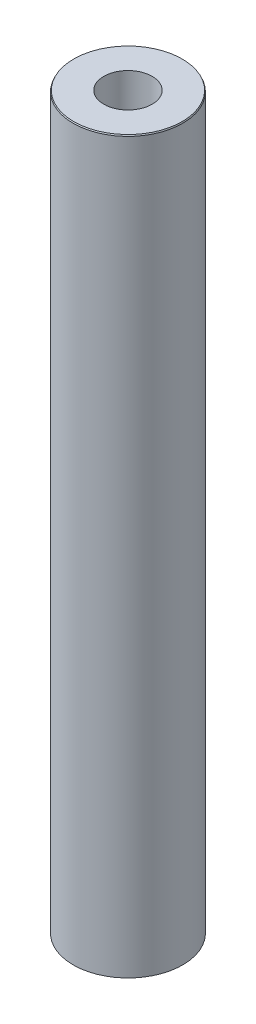
from build123d import *
from OCP.BRepFilletAPI import BRepFilletAPI_MakeChamfer

# Parameters (mm, degrees)
SKETCH1_R           = 45
BOSS_EXTRUDE1_DEPTH = 600
SKETCH2_R           = 19.865410458
CUT_EXTRUDE1_DEPTH  = 604.365560834
CHAMFER1_SIZE       = 0.995548433
CHAMFER1_SIZE2      = 0.469440044


with BuildPart() as part:
    # Sketch1 → Boss-Extrude1 (new body)
    with BuildSketch(Plane(origin=(0, 0, 0), x_dir=(1, 0, 0), z_dir=(0, 1, 0))):
        Circle(SKETCH1_R)
    extrude(amount=BOSS_EXTRUDE1_DEPTH)

    # Sketch2 → Cut-Extrude1 (cut, through all)
    with BuildSketch(Plane(origin=(0, 0, 0), x_dir=(1, 0, 0), z_dir=(0, 1, 0))):
        Circle(SKETCH2_R)
    extrude(amount=CUT_EXTRUDE1_DEPTH, mode=Mode.SUBTRACT)

    # Chamfer1: one chamfer whose edges measure the first distance from different faces: ONE call of the kernel's chamfer builder (chamfer() names one face for all edges)
    chamfer1_edges_1 = [part.edges().sort_by_distance(p)[0] for p in [
        (-45, 600, 0),
    ]]
    chamfer1_side_1 = [part.faces().sort_by_distance(p)[0] for p in [
        (-45, 300, 0),
    ]]
    chamfer1_edges_2 = [part.edges().sort_by_distance(p)[0] for p in [
        (-45, 0, 0),
    ]]
    chamfer1_side_2 = [part.faces().sort_by_distance(p)[0] for p in [
        (-43.727207794, 0, 0),
    ]]
    chamfer1 = BRepFilletAPI_MakeChamfer(part.part.solid().wrapped)
    for e in chamfer1_edges_1:
        chamfer1.Add(CHAMFER1_SIZE, CHAMFER1_SIZE2, e.wrapped, chamfer1_side_1[0].wrapped)  # the first distance lies on this face
    for e in chamfer1_edges_2:
        chamfer1.Add(CHAMFER1_SIZE, CHAMFER1_SIZE2, e.wrapped, chamfer1_side_2[0].wrapped)  # the first distance lies on this face
    add(Compound.cast(chamfer1.Shape()), mode=Mode.REPLACE)


solid = part.part
